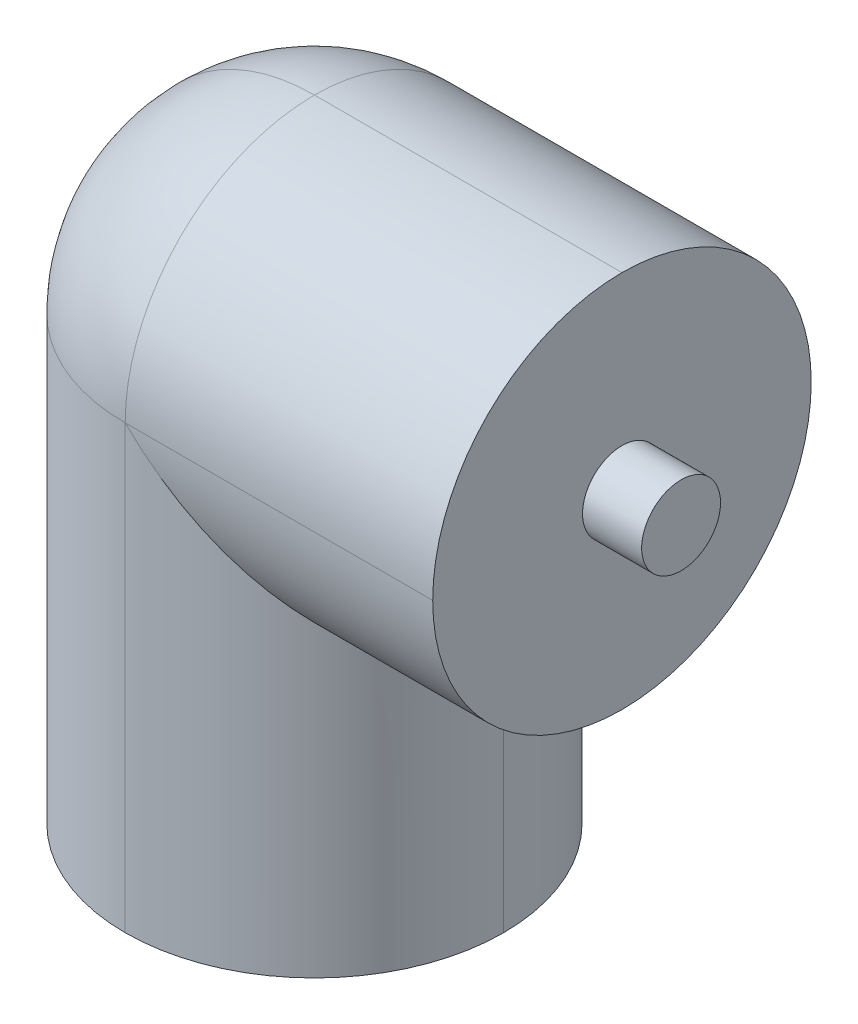
from build123d import *

# Parameters (mm, degrees)
SKETCH1_W           = 48
SKETCH1_H           = 48
BOSS_EXTRUDE1_DEPTH = 80
SKETCH2_W           = 48
SKETCH2_H           = 48
BOSS_EXTRUDE2_DEPTH = 15
FILLET2_R           = 24
SKETCH3_R           = 5
BOSS_EXTRUDE3_DEPTH = 7.5
SKETCH4_R           = 5
BOSS_EXTRUDE4_DEPTH = 7.5


with BuildPart() as part:
    # Sketch1 → Boss-Extrude1 (new body)
    with BuildSketch(Plane(origin=(0, 0, 0), x_dir=(1, 0, 0), z_dir=(0, 1, 0))):
        with Locations((24, 24)):
            Rectangle(SKETCH1_W, SKETCH1_H)
    extrude(amount=BOSS_EXTRUDE1_DEPTH)

    # Sketch2 → Boss-Extrude2 (add)
    with BuildSketch(Plane(origin=(48, 0, 0), x_dir=(0, 0, -1), z_dir=(1, 0, 0))):
        with Locations((24, 56)):
            Rectangle(SKETCH2_W, SKETCH2_H)
    extrude(amount=BOSS_EXTRUDE2_DEPTH)

    # Fillet2
    fillet2_edges = [part.edges().sort_by_distance(p)[0] for p in [
        (48, 16, -48),
        (48, 16, 0),
        (55.5, 32, 0),
        (31.5, 80, -48),
        (55.5, 32, -48),
        (0, 80, -24),
        (0, 40, -48),
        (0, 40, 0),
        (31.5, 80, 0),
    ]]
    fillet(fillet2_edges, radius=FILLET2_R - 0.0001)  # a hair under: the kernel refuses the full size

    # Sketch3 → Boss-Extrude3 (add, symmetric)
    with BuildSketch(Plane(origin=(0, 0, 0), x_dir=(-1, 0, 0), z_dir=(0, -1, 0))):
        with Locations(Location((-24, 24, 0), (0, 0, 90))):
            Circle(SKETCH3_R)
    extrude(amount=BOSS_EXTRUDE3_DEPTH, both=True)

    # Sketch4 → Boss-Extrude4 (add, symmetric)
    with BuildSketch(Plane(origin=(63, 0, 0), x_dir=(0, 0, -1), z_dir=(1, 0, 0))):
        with Locations((24, 56)):
            Circle(SKETCH4_R)
    extrude(amount=BOSS_EXTRUDE4_DEPTH, both=True)


solid = part.part
